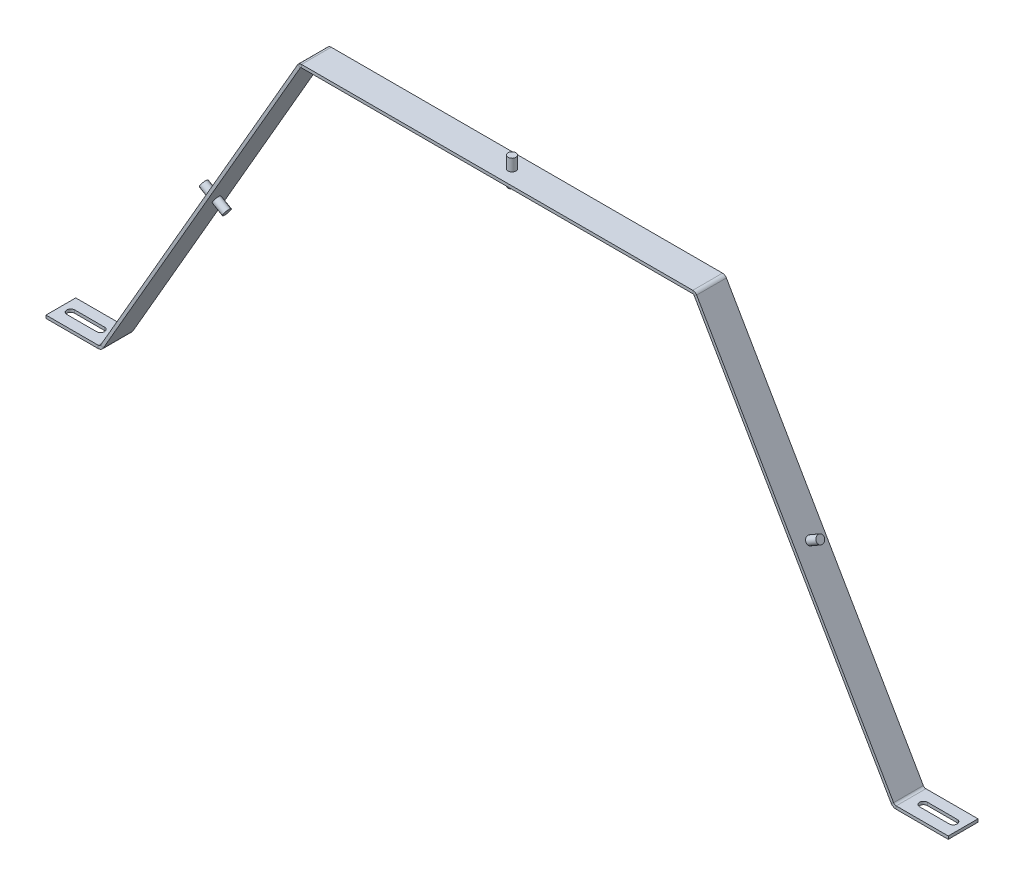
from build123d import *

# Parameters (mm, degrees)
EXTRUDE_1_DEPTH        = 15
CUT_EXTRUDE_1_REACH    = 576.925
SHEET_START            = -15
SHEET_METAL_2_DEPTH    = 30
SHEET_METAL_2_2_DEPTH  = 30
EXTRUDE_2_DEPTH        = 12
EXTRUDE_2_DEPTH_BACK   = 15
SKETCH_4_R             = 4
SKETCH_4_2_R           = 4
CUT_EXTRUDE_5_DEPTH    = 900.582139681
EXTRUDE_1_2_DEPTH      = 12
EXTRUDE_1_2_DEPTH_BACK = 15
SKETCH_3_R             = 4
SKETCH_3_2_R           = 4
CUT_EXTRUDE_6_DEPTH    = 575.925257869


# Read off the part's stored shape, not the designer's step: Преобразовать-Твердое тело2
with BuildPart() as part:
    # Эскиз1 → Extrude 1 (new, symmetric)
    with BuildSketch(Plane.XY):
        with BuildLine():
            Line((-455.166025404, 195.187225691), (-402.598076211, 195.187225691))
            ThreePointArc((-402.598076211, 195.187225691), (-401.098076211, 195.58914948), (-400, 196.687225691))
            Line((-400, 196.687225691), (-200.433012702, 542.347387205))
            ThreePointArc((-200.433012702, 542.347387205), (-199.883974596, 542.896425311), (-199.133974596, 543.097387205))
            Line((-199.133974596, 543.097387205), (199.133974596, 543.097387205))
            ThreePointArc((199.133974596, 543.097387205), (199.883974596, 542.896425311), (200.433012702, 542.347387205))
            Line((200.433012702, 542.347387205), (400, 196.687225691))
            ThreePointArc((400, 196.687225691), (401.098076211, 195.58914948), (402.598076211, 195.187225691))
            Line((402.598076211, 195.187225691), (455.166025404, 195.187225691))
            Line((455.166025404, 195.187225691), (455.166025404, 192.187225691))
            Line((455.166025404, 192.187225691), (402.598076211, 192.187225691))
            ThreePointArc((402.598076211, 192.187225691), (399.598076211, 192.991073269), (397.401923789, 195.187225691))
            Line((397.401923789, 195.187225691), (198.267949192, 540.097387205))
            Line((198.267949192, 540.097387205), (-198.267949192, 540.097387205))
            Line((-198.267949192, 540.097387205), (-397.401923789, 195.187225691))
            ThreePointArc((-397.401923789, 195.187225691), (-399.598076211, 192.991073269), (-402.598076211, 192.187225691))
            Line((-402.598076211, 192.187225691), (-455.166025404, 192.187225691))
            Line((-455.166025404, 192.187225691), (-455.166025404, 195.187225691))
        make_face()
    extrude(amount=EXTRUDE_1_DEPTH, both=True)

    # Эскиз2 → Вырез-Вытянуть1 (cut, up to next)
    with BuildSketch(Plane.XZ.offset(-192.187225691), mode=Mode.PRIVATE) as cut_extrude_1_sk1:
        with BuildLine():
            Line((-445.16238786, -4), (-415.16238786, -4))
            ThreePointArc((-415.16238786, -4), (-411.16238786, 0), (-415.16238786, 4))
            Line((-415.16238786, 4), (-445.16238786, 4))
            ThreePointArc((-445.16238786, 4), (-449.16238786, 0), (-445.16238786, -4))
        make_face()
    cut_extrude_1_tool1 = extrude(cut_extrude_1_sk1.sketch, amount=-CUT_EXTRUDE_1_REACH, mode=Mode.PRIVATE) & part.part
    # Эскиз2 → Вырез-Вытянуть1 (cut, up to next)
    with BuildSketch(Plane.XZ.offset(-192.187225691), mode=Mode.PRIVATE) as cut_extrude_1_sk2:
        with BuildLine():
            Line((445.16238786, 4), (415.16238786, 4))
            ThreePointArc((415.16238786, 4), (411.16238786, 0), (415.16238786, -4))
            Line((415.16238786, -4), (445.16238786, -4))
            ThreePointArc((445.16238786, -4), (449.16238786, 0), (445.16238786, 4))
        make_face()
    cut_extrude_1_tool2 = extrude(cut_extrude_1_sk2.sketch, amount=-CUT_EXTRUDE_1_REACH, mode=Mode.PRIVATE) & part.part
    add(cut_extrude_1_tool1.solids().sort_by_distance((-430.162388, 192.187226, 0))[0], mode=Mode.SUBTRACT)
    add(cut_extrude_1_tool2.solids().sort_by_distance((430.162388, 192.187226, 0))[0], mode=Mode.SUBTRACT)

    # Sheet Metal 2 outline → Sheet Metal 2 (cut)
    with BuildSketch(Plane.XY.offset(SHEET_START)):
        with BuildLine():
            Line((199.133974596, 543.097387205), (197.401923789, 543.097387205))
            ThreePointArc((197.401923789, 543.097387205), (199.651923789, 542.494501522), (201.299038106, 540.847387205))
            Line((201.299038106, 540.847387205), (200.433012702, 542.347387205))
            ThreePointArc((200.433012702, 542.347387205), (199.883974596, 542.896425311), (199.133974596, 543.097387205))
        make_face()
        with BuildLine():
            ThreePointArc((-201.299038106, 540.847387205), (-199.651923789, 542.494501522), (-197.401923789, 543.097387205))
            Line((-197.401923789, 543.097387205), (-199.133974596, 543.097387205))
            ThreePointArc((-199.133974596, 543.097387205), (-199.883974596, 542.896425311), (-200.433012702, 542.347387205))
            Line((-200.433012702, 542.347387205), (-201.299038106, 540.847387205))
        make_face()
    extrude(amount=SHEET_METAL_2_DEPTH, mode=Mode.SUBTRACT)

    # Sheet Metal 2 2 outline → Sheet Metal 2 2 (add)
    with BuildSketch(Plane.XY.offset(SHEET_START)):
        with BuildLine():
            Line((198.267949192, 540.097387205), (197.401923789, 540.097387205))
            ThreePointArc((197.401923789, 540.097387205), (198.151923789, 539.896425311), (198.700961894, 539.347387205))
            Line((198.700961894, 539.347387205), (198.267949192, 540.097387205))
        make_face()
        with BuildLine():
            ThreePointArc((-198.700961894, 539.347387205), (-198.151923789, 539.896425311), (-197.401923789, 540.097387205))
            Line((-197.401923789, 540.097387205), (-198.267949192, 540.097387205))
            Line((-198.267949192, 540.097387205), (-198.700961894, 539.347387205))
        make_face()
    extrude(amount=SHEET_METAL_2_2_DEPTH)

    # Эскиз4<2> → Вырез-Вытянуть5 (cut, through all)
    with BuildSketch(Plane(origin=(-385.168067024, 222.37688718, 0), x_dir=(0, 0, 1), z_dir=(-0.8660254037844389, 0.49999999999999983, 0))):
        with Locations(Location((0, 169.037095943, 0), (0, 0, 270))):
            Circle(SKETCH_4_2_R)
    cut_extrude_5 = extrude(amount=-CUT_EXTRUDE_5_DEPTH, mode=Mode.SUBTRACT)

    # Эскиз3<2> → Вырез-Вытянуть6 (cut, through all)
    with BuildSketch(Plane(origin=(0, 543.097387205, 0), x_dir=(1, 0, 0), z_dir=(0, 1, 0))):
        Circle(SKETCH_3_2_R)
    extrude(amount=-CUT_EXTRUDE_6_DEPTH, mode=Mode.SUBTRACT)

    # Зеркальное отражение6: Вырез-Вытянуть5 across plane
    add(cut_extrude_5.mirror(Plane(origin=(0, 0, 0), x_dir=(0, 0, 1), z_dir=(1, 0, 0))), mode=Mode.SUBTRACT)


with BuildPart() as body_2:
    # Sketch 4 → Бобышка-Вытянуть2 (new, two sides: drawn at the far end of the back side and taken through both)
    with BuildSketch(Plane(origin=(-385.168067024, 222.37688718, 0), x_dir=(0, 0, 1), z_dir=(-0.8660254037844389, 0.49999999999999983, 0)).offset(-EXTRUDE_2_DEPTH_BACK)):
        with Locations(Location((0, 169.037095943, 0), (0, 0, 270))):
            Circle(SKETCH_4_R)
    extrude(amount=EXTRUDE_2_DEPTH + EXTRUDE_2_DEPTH_BACK)


with BuildPart() as body_3:
    # Sketch 3 → Extrude 1 2 (new, two sides: drawn at the far end of the back side and taken through both)
    with BuildSketch(Plane(origin=(0, 543.097387205, 0), x_dir=(1, 0, 0), z_dir=(0, 1, 0)).offset(-EXTRUDE_1_2_DEPTH_BACK)):
        Circle(SKETCH_3_R)
    extrude(amount=EXTRUDE_1_2_DEPTH + EXTRUDE_1_2_DEPTH_BACK)


with BuildPart() as body_4:
    # Зеркальное отражение5: mirrored copy
    add(body_2.part.mirror(Plane(origin=(0, 0, 0), x_dir=(0, 0, 1), z_dir=(1, 0, 0))))


solid = Compound([part.part, body_2.part, body_3.part, body_4.part])
